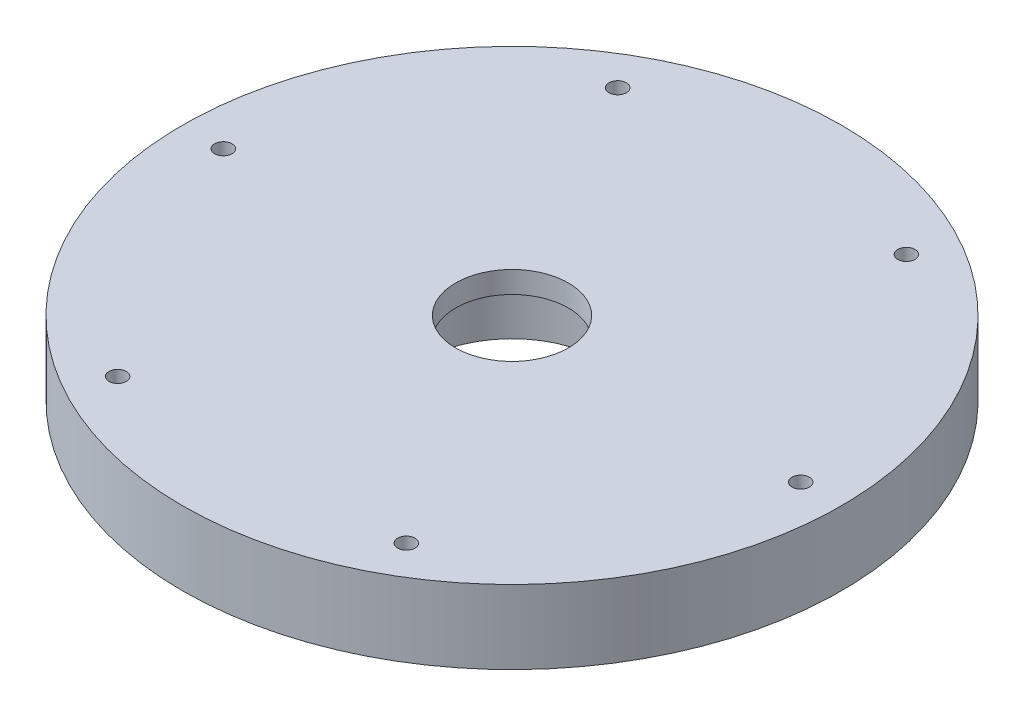
from build123d import *

# Parameters (mm, degrees)
SKETCH2_R          = 1
CUT_EXTRUDE1_DEPTH = 55.617419382


with BuildPart() as part:
    # Sketch1 → Revolve1 (revolve)
    with BuildSketch(Plane.XY):
        Polygon((-6.5, 0), (-38, 0), (-38, -8.5), (-35, -8.5), (-35, -9.75), (-10.5, -9.75), (-10.5, -2.5), (-6.5, -2.5), align=None)
    revolve(axis=Axis((0, 38.708668819, 0), (0, -1, 0)))

    # Sketch2 → Cut-Extrude1 (cut, through all)
    with BuildSketch(Plane.XZ.offset(9.75)):
        with Locations((-33.2875, 0)):
            Circle(SKETCH2_R)
        with Locations((-16.64375, 28.827820628)):
            Circle(SKETCH2_R)
        with Locations((16.64375, 28.827820628)):
            Circle(SKETCH2_R)
        with Locations((33.2875, 0)):
            Circle(SKETCH2_R)
        with Locations((16.64375, -28.827820628)):
            Circle(SKETCH2_R)
        with Locations((-16.64375, -28.827820628)):
            Circle(SKETCH2_R)
    extrude(amount=-CUT_EXTRUDE1_DEPTH, mode=Mode.SUBTRACT)


solid = part.part
